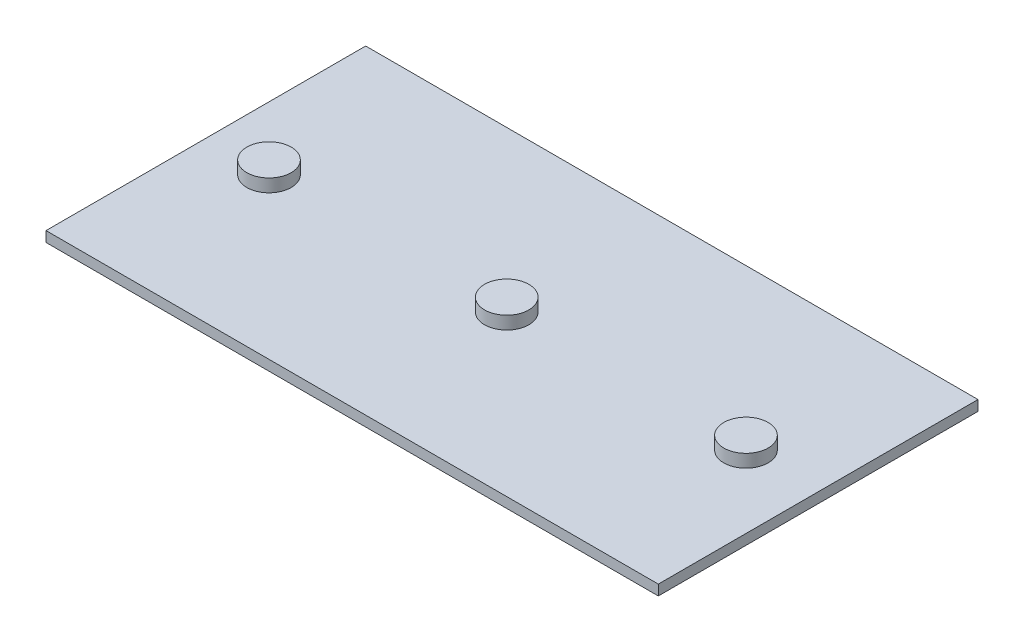
from build123d import *

# Parameters (mm, degrees)
ESQUISSE1_W        = 118.75
ESQUISSE1_H        = 62
BOSS_EXTRU_1_DEPTH = 2
ESQUISSE2_W        = 15
ESQUISSE2_H        = 15.6
BOSS_EXTRU_2_DEPTH = 4
ESQUISSE3_R        = 4.3
BOSS_EXTRU_3_DEPTH = 2.5


with BuildPart() as part:
    # Esquisse1 → Boss.-Extru.1 (new body)
    with BuildSketch(Plane(origin=(0, 0, 0), x_dir=(1, 0, 0), z_dir=(0, 1, 0))):
        with Locations((59.375, -31)):
            Rectangle(ESQUISSE1_W, ESQUISSE1_H)
    extrude(amount=BOSS_EXTRU_1_DEPTH)

    # Esquisse2 → Boss.-Extru.2 (add)
    with BuildSketch(Plane.XZ):
        with Locations((103.25, 30.8)):
            Rectangle(ESQUISSE2_W, ESQUISSE2_H)
    extrude(amount=BOSS_EXTRU_2_DEPTH)

    # Esquisse3 → Boss.-Extru.3 (add)
    with BuildSketch(Plane(origin=(0, 2, 0), x_dir=(1, 0, 0), z_dir=(0, 1, 0))):
        with Locations((104.75, -31)):
            Circle(ESQUISSE3_R)
        with Locations((58.35, -31)):
            Circle(ESQUISSE3_R)
        with Locations((12.25, -31)):
            Circle(ESQUISSE3_R)
    extrude(amount=BOSS_EXTRU_3_DEPTH)


solid = part.part
